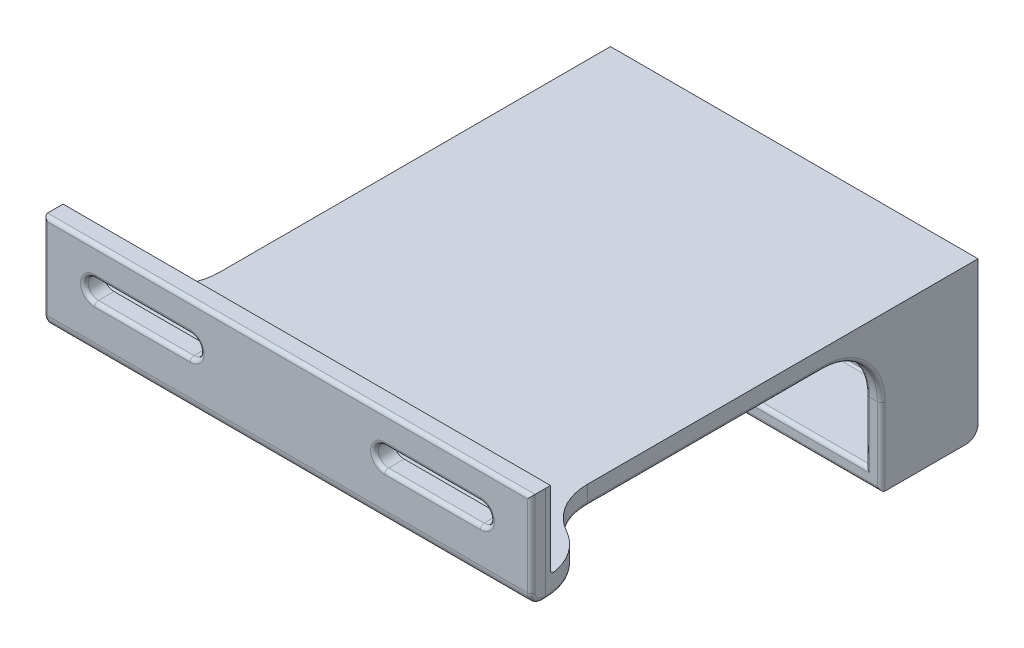
from build123d import *

# Parameters (mm, degrees)
SKETCH2_W           = 126
SKETCH2_H           = 20
SKETCH2_H_2         = 4.999999999999998
BOSS_EXTRUDE1_DEPTH = 5
CUT_EXTRUDE1_DEPTH  = 5
SKETCH4_W           = 126
SKETCH4_H           = 4.999999999999998
BOSS_EXTRUDE3_DEPTH = 10
SKETCH5_W           = 95
SKETCH5_H           = 4.999999999999998
BOSS_EXTRUDE4_DEPTH = 116
SKETCH6_W           = 95
SKETCH6_H           = 4
BOSS_EXTRUDE5_DEPTH = 35
BOSS_EXTRUDE6_DEPTH = 21
FILLET2_R           = 15
FILLET3_R           = 15
FILLET4_R           = 3
FILLET5_R           = 15
FILLET6_R           = 0.5
FILLET7_R           = 3
FILLET8_R           = 1
FILLET9_R           = 1


with BuildPart() as part:
    # Sketch2 → Boss-Extrude1 (new body)
    with BuildSketch(Plane.XY):
        with Locations((-1.976721396074229, 0.2999999999999954)):
            Rectangle(SKETCH2_W, SKETCH2_H)
        with Locations((-1.976721396074229, -12.200000000000003)):
            Rectangle(SKETCH2_W, SKETCH2_H_2)
    extrude(amount=BOSS_EXTRUDE1_DEPTH)

    # Sketch3 → Cut-Extrude1 (cut)
    with BuildSketch(Plane(origin=(0, 0, 0), x_dir=(-1, 0, 0), z_dir=(0, 0, -1))):
        with BuildLine():
            Line((27.126721396074235, 2.6), (51.82672139607423, 2.6))
            ThreePointArc((51.82672139607423, 2.6), (54.476721396074225, -0.04999999999999918), (51.82672139607423, -2.6999999999999984))
            Line((51.82672139607423, -2.6999999999999984), (27.126721396074235, -2.6999999999999984))
            ThreePointArc((27.126721396074235, -2.6999999999999984), (24.476721396074236, -0.04999999999999894), (27.126721396074235, 2.6))
        make_face()
        with BuildLine():
            Line((-23.173278603925766, -2.7000000000000055), (-47.87327860392578, -2.7000000000000055))
            ThreePointArc((-47.87327860392578, -2.7000000000000055), (-50.52327860392578, -0.05000000000000848), (-47.87327860392578, 2.5999999999999885))
            Line((-47.87327860392578, 2.5999999999999885), (-23.173278603925766, 2.5999999999999948))
            ThreePointArc((-23.173278603925766, 2.5999999999999948), (-20.523278603925768, -0.05000000000000534), (-23.173278603925766, -2.7000000000000055))
        make_face()
    extrude(amount=-CUT_EXTRUDE1_DEPTH, mode=Mode.SUBTRACT)

    # Sketch4 → Boss-Extrude3 (add)
    with BuildSketch(Plane(origin=(0, 0, 0), x_dir=(-1, 0, 0), z_dir=(0, 0, -1))):
        with Locations((1.976721396074229, -12.200000000000003)):
            Rectangle(SKETCH4_W, SKETCH4_H)
    extrude(amount=BOSS_EXTRUDE3_DEPTH)

    # Sketch5 → Boss-Extrude4 (add)
    with BuildSketch(Plane(origin=(0, 0, -10), x_dir=(-1, 0, 0), z_dir=(0, 0, -1))):
        with Locations((1.9767213960742254, -12.200000000000003)):
            Rectangle(SKETCH5_W, SKETCH5_H)
    extrude(amount=BOSS_EXTRUDE4_DEPTH)

    # Sketch6 → Boss-Extrude5 (add)
    with BuildSketch(Plane.XZ.offset(14.700000000000005)):
        with Locations((-1.9767213960742254, -124.00000000000001)):
            Rectangle(SKETCH6_W, SKETCH6_H)
    extrude(amount=BOSS_EXTRUDE5_DEPTH)

    # Sketch7 → Boss-Extrude6 (add)
    with BuildSketch(Plane.XY.offset(-122)):
        Polygon((-49.476721396074225, -30.70000000000001), (-49.476721396074225, -49.70000000000001), (45.523278603925775, -49.70000000000001), (45.523278603925775, -14.700000000000005), (41.52327860392578, -14.700000000000005), (41.52327860392579, -45.7), (-45.47672139607422, -45.70000000000002), (-45.476721396074225, -30.70000000000001), align=None)
    extrude(amount=BOSS_EXTRUDE6_DEPTH)

    # Fillet2
    fillet2_edges = [part.edges().sort_by_distance(p)[0] for p in [
        (45.523278603925775, -12.200000000000005, -10),
        (-49.476721396074225, -12.200000000000005, -10),
    ]]
    fillet(fillet2_edges, radius=FILLET2_R)

    # Fillet3
    # the kernel refuses this fillet: 15 mm, written as the material it takes off along each edge
    with BuildSketch(Plane(origin=(61.02327860392577, -42.857729933344494, -10), x_dir=(-0.9721461368215704, 0, -0.23437552914691517), z_dir=(0, 1, 0))) as fillet3_piece_1:
        with BuildLine():
            CenterArc((11.942398911242131, 14.4650042877501), FILLET3_R, 193.55481522372781, 61.096665460152735)
            Line((-2.6397931410814257, 10.949371350546373), (-4.098012346313782, 10.597808056826002))
            Line((-4.098012346313782, 10.597808056826002), (-1.4582192052323555, -0.35156329372037276))
            Line((-1.4582192052323555, -0.35156329372037276), (0.35156329372037276, -1.4582192052323555))
            ThreePointArc((0.35156329372037276, -1.4582192052323555), (0.8376363621311502, -1.3410314406588961), (7.575017813146935, -1.4465004287750098))
            Line((7.575017813146935, -1.4465004287750098), (7.972052458428318, 6e-17))
        make_face()
    extrude(amount=61.31545986668898, mode=Mode.SUBTRACT)
    with BuildSketch(Plane(origin=(-64.97672139607423, 18.45772993334451, -10), x_dir=(0.9721461368215705, 0, -0.23437552914691476), z_dir=(0, -1, 0))) as fillet3_piece_2:
        with BuildLine():
            CenterArc((11.942398911242128, 14.4650042877501), FILLET3_R, 193.55481522372781, 61.096665460152735)
            Line((-2.63979314108143, 10.949371350546382), (-4.098012346313785, 10.59780805682601))
            Line((-4.098012346313785, 10.59780805682601), (-1.4582192052323557, -0.35156329372037215))
            Line((-1.4582192052323557, -0.35156329372037215), (0.35156329372037215, -1.4582192052323557))
            ThreePointArc((0.35156329372037215, -1.4582192052323557), (0.8376363621311566, -1.3410314406588948), (7.575017813146934, -1.4465004287750098))
            Line((7.575017813146934, -1.4465004287750098), (7.972052458428317, -3e-17))
        make_face()
    extrude(amount=61.315459866689025, mode=Mode.SUBTRACT)

    # Fillet4
    fillet4_edges = [part.edges().sort_by_distance(p)[0] for p in [
        (-1.9767213960742254, -49.7, -126),
    ]]
    fillet(fillet4_edges, radius=FILLET4_R)

    # Fillet5
    fillet5_edges = [part.edges().sort_by_distance(p)[0] for p in [
        (43.523278603925775, -14.700000000000005, -101),
    ]]
    fillet(fillet5_edges, radius=FILLET5_R)

    # Fillet6
    fillet6_edges = [part.edges().sort_by_distance(p)[0] for p in [
        (-3.9767213960742183, -14.700000000000005, -122),
        (-47.476721396074225, -30.70000000000001, -122),
        (41.52327860392579, -30.200000000000003, -122),
        (-1.9767213960742112, -45.70000000000001, -122),
        (-45.476721396074225, -38.20000000000002, -122),
    ]]
    fillet(fillet6_edges, radius=FILLET6_R)

    # Fillet7
    fillet7_edges = [part.edges().sort_by_distance(p)[0] for p in [
        (-1.9767213960742325, -14.700000000000005, 5),
    ]]
    fillet(fillet7_edges, radius=FILLET7_R)

    # Fillet8
    fillet8_edges = [part.edges().sort_by_distance(p)[0] for p in [
        (-1.976721396074005, -9.700000000000005, 0),
    ]]
    fillet(fillet8_edges, radius=FILLET8_R)

    # Fillet9
    # the kernel refuses this fillet: 1 mm, written as the material it takes off along each edge
    with BuildSketch(Plane(origin=(-48.476721396074225, -31.70000000000001, -102), x_dir=(0, 0, 1), z_dir=(0, 1, 0))) as fillet9_piece_1_section:
        Polygon((0, 0), (FILLET9_R * 1.02, 0), (FILLET9_R * 1.02, -FILLET9_R * 1.02), (0, -FILLET9_R * 1.02), align=None)
    fillet9_piece_1 = extrude(amount=FILLET9_R * 1.02, mode=Mode.PRIVATE)
    fillet9_piece_1 = fillet9_piece_1 - Plane(origin=(-48.476721396074225, -31.70000000000001, -102), x_dir=(0.7071067811865475, 0, -0.7071067811865475), z_dir=(0, 1, 0)) * Sphere(FILLET9_R, mode=Mode.PRIVATE)
    add(fillet9_piece_1, mode=Mode.SUBTRACT)
    with BuildSketch(Plane(origin=(60.523278603925775, -14.700000000000005, -24.999999999999996), x_dir=(-1, 0, 0), z_dir=(0, 0, -1))) as fillet9_piece_2:
        with BuildLine():
            CenterArc((15 + FILLET9_R, FILLET9_R), FILLET9_R, 180, 90)
            Line((15, FILLET9_R), (15, 0))
            Line((15, 0), (15 + FILLET9_R, 0))
        make_face()
    revolve(axis=Axis((60.523278603925775, -14.700000000000005, -24.999999999999996), (0, 1, 0)), revolution_arc=61.09666546015381, mode=Mode.SUBTRACT)
    with BuildSketch(Plane(origin=(-64.47672139607423, -14.700000000000005, -24.999999999999996), x_dir=(0.483333333333338, 0, 0.8754363991112571), z_dir=(-0.8754363991112571, 0, 0.483333333333338))) as fillet9_piece_3:
        with BuildLine():
            CenterArc((15.000000000000005 + FILLET9_R, FILLET9_R), FILLET9_R, 180, 90.00000000000023)
            Line((15.000000000000005 + FILLET9_R, 0), (15.000000000000005, 0))
            Line((15.000000000000005, 0), (15.000000000000005, FILLET9_R))
        make_face()
    revolve(axis=Axis((-64.47672139607423, -14.700000000000005, -24.999999999999996), (0, 1, 0)), revolution_arc=61.09666546015241, mode=Mode.SUBTRACT)
    with BuildSketch(Plane(origin=(-49.97672139607436, -14.700000000000003, 1.2630919733380015), x_dir=(-0.48333333333331013, 0, -0.8754363991112726), z_dir=(0.8754363991112726, 0, -0.48333333333331013))) as fillet9_piece_4:
        with BuildLine():
            CenterArc((15 - FILLET9_R, FILLET9_R), FILLET9_R, 269.9999999999998, 90.00000000000023)
            Line((15 - FILLET9_R, 0), (15, 0))
            Line((15, 0), (15, FILLET9_R))
        make_face()
    revolve(axis=Axis((-49.97672139607436, -14.700000000000003, 1.2630919733380015), (0, 1, 0)), revolution_arc=61.096665460153005, mode=Mode.SUBTRACT)
    with BuildSketch(Plane(origin=(46.023278603926364, -14.700000000000003, 1.2630919733380015), x_dir=(0.48333333333331013, 0, -0.8754363991112726), z_dir=(-0.8754363991112726, 0, -0.48333333333331013))) as fillet9_piece_5:
        with BuildLine():
            CenterArc((15 - FILLET9_R, -FILLET9_R), FILLET9_R, 359.9999999999999, 90.00000000000011)
            Line((15, -FILLET9_R), (15, 0))
            Line((15, 0), (15 - FILLET9_R, 1.78e-15))
        make_face()
    revolve(axis=Axis((46.023278603926364, -14.700000000000003, 1.2630919733380015), (0, -1, 0)), revolution_arc=61.096665460153005, mode=Mode.SUBTRACT)
    with BuildSketch(Plane(origin=(41.52327860392578, -29.700000000000003, -101), x_dir=(0, 0, -1), z_dir=(2.3e-16, -1, 0))) as fillet9_piece_6:
        with BuildLine():
            CenterArc((FILLET9_R, FILLET9_R), FILLET9_R, 180, 90)
            Line((0, FILLET9_R), (0, 0))
            Line((0, 0), (FILLET9_R, 0))
        make_face()
    extrude(amount=16, mode=Mode.SUBTRACT)
    with BuildSketch(Plane(origin=(45.523278603925775, -14.700000000000005, -24.999999999999996), x_dir=(-1, 0, 0), z_dir=(0, 0, -1))) as fillet9_piece_7:
        with BuildLine():
            CenterArc((FILLET9_R, FILLET9_R), FILLET9_R, 180, 90)
            Line((0, FILLET9_R), (0, 0))
            Line((0, 0), (FILLET9_R, 0))
        make_face()
    extrude(amount=61, mode=Mode.SUBTRACT)
    with BuildSketch(Plane(origin=(41.52327860392579, -29.7, -86), x_dir=(0, 0, -1), z_dir=(0, -1, 0))) as fillet9_piece_8_section:
        with BuildLine():
            CenterArc((15 + FILLET9_R, FILLET9_R), FILLET9_R, 179.9999999999996, 90.0000000000004)
            Line((15, FILLET9_R), (15, 0))
            Line((15, 0), (15 + FILLET9_R, -7.11e-15))
        make_face()
    fillet9_piece_8 = revolve(axis=Axis((41.52327860392579, -29.7, -86), (1, 0, 0)), revolution_arc=118.65939784747897, mode=Mode.PRIVATE)
    fillet9_piece_8 = split(fillet9_piece_8, bisect_by=Plane(origin=(41.52327860392579, -14.700000000000005, -86), z_dir=(0, -1, 0)), keep=Keep.TOP, mode=Mode.PRIVATE)
    add(fillet9_piece_8, mode=Mode.SUBTRACT)
    with BuildSketch(Plane(origin=(45.523278603925775, -29.7, -86), x_dir=(0, 0, -1), z_dir=(0, -1, 0))) as fillet9_piece_9:
        with BuildLine():
            CenterArc((15 + FILLET9_R, -FILLET9_R), FILLET9_R, 90, 90)
            Line((15, -FILLET9_R), (15, 0))
            Line((15, 0), (15 + FILLET9_R, 0))
        make_face()
    revolve(axis=Axis((45.523278603925775, -29.7, -86), (1, 0, 0)), revolution_arc=90, mode=Mode.SUBTRACT)
    with BuildSketch(Plane(origin=(-49.476721396074225, -15.200000000000005, -122), x_dir=(0, 0, -1), z_dir=(0, -1, 0))) as fillet9_piece_10:
        with BuildLine():
            CenterArc((FILLET9_R, FILLET9_R), FILLET9_R, 180, 90)
            Line((0, FILLET9_R), (0, 0))
            Line((0, 0), (FILLET9_R, 0))
        make_face()
    extrude(amount=15.000000000000005, mode=Mode.SUBTRACT)
    with BuildSketch(Plane(origin=(-49.476721396074225, -14.700000000000005, -25), x_dir=(1, 0, 0), z_dir=(0, 0, -1))) as fillet9_piece_11:
        with BuildLine():
            CenterArc((FILLET9_R, -FILLET9_R), FILLET9_R, 90, 90)
            Line((-7.11e-15, -FILLET9_R), (0, 0))
            Line((0, 0), (FILLET9_R, 0))
        make_face()
    extrude(amount=96.5, mode=Mode.SUBTRACT)
    with BuildSketch(Plane(origin=(-49.476721396074225, -30.20000000000001, -121.5), x_dir=(0, 0, -1), z_dir=(0, 1, 0))) as fillet9_piece_12:
        with BuildLine():
            CenterArc((0.5 + FILLET9_R, -FILLET9_R), FILLET9_R, 90, 90)
            Line((0.5, -FILLET9_R), (0.5, 0))
            Line((0.5, 0), (0.5 + FILLET9_R, 0))
        make_face()
    revolve(axis=Axis((-49.476721396074225, -30.20000000000001, -121.5), (-1, 0, 0)), revolution_arc=90, mode=Mode.SUBTRACT)
    with BuildSketch(Plane(origin=(-49.47672139607422, -15.200000000000005, -121.5), x_dir=(0, 0, -1), z_dir=(0, -1, 0))) as fillet9_piece_13:
        with BuildLine():
            CenterArc((0.5 + FILLET9_R, FILLET9_R), FILLET9_R, 179.9999999999996, 90.0000000000004)
            Line((0.5, FILLET9_R), (0.5, 0))
            Line((0.5, 0), (0.5 + FILLET9_R, -7.11e-15))
        make_face()
    revolve(axis=Axis((-49.47672139607422, -15.200000000000005, -121.5), (1, 0, 0)), revolution_arc=90, mode=Mode.SUBTRACT)
    with BuildSketch(Plane(origin=(-64.97672139607423, 12.799999999999995, 5), x_dir=(0, 0, -1), z_dir=(0, -1, 0))) as fillet9_piece_14:
        with BuildLine():
            CenterArc((FILLET9_R, FILLET9_R), FILLET9_R, 180, 90)
            Line((0, FILLET9_R), (0, 0))
            Line((0, 0), (FILLET9_R, 0))
        make_face()
    extrude(amount=24.5, mode=Mode.SUBTRACT)
    with BuildSketch(Plane(origin=(61.02327860392577, 12.799999999999995, 5), x_dir=(-1, 0, 0), z_dir=(0, -1, 0))) as fillet9_piece_15:
        with BuildLine():
            CenterArc((FILLET9_R, FILLET9_R), FILLET9_R, 180, 90)
            Line((0, FILLET9_R), (0, 0))
            Line((0, 0), (FILLET9_R, 0))
        make_face()
    extrude(amount=24.5, mode=Mode.SUBTRACT)
    with BuildSketch(Plane(origin=(61.02327860392577, -14.700000000000005, 2.0000000000000004), x_dir=(-1, 0, 0), z_dir=(0, 0, -1))) as fillet9_piece_16:
        with BuildLine():
            CenterArc((FILLET9_R, FILLET9_R), FILLET9_R, 180, 90)
            Line((0, FILLET9_R), (0, 0))
            Line((0, 0), (FILLET9_R, 0))
        make_face()
    extrude(amount=0.7369080266624892, mode=Mode.SUBTRACT)
    with BuildSketch(Plane(origin=(61.02327860392577, -11.700000000000005, 2.0000000000000004), x_dir=(0, -1, 0), z_dir=(0, 0, -1))) as fillet9_piece_17:
        with BuildLine():
            CenterArc((3.0000000000000018 - FILLET9_R, FILLET9_R), FILLET9_R, 270, 90)
            Line((3.0000000000000018, FILLET9_R), (3.0000000000000018, 0))
            Line((3.0000000000000018, 0), (3.0000000000000018 - FILLET9_R, 0))
        make_face()
    revolve(axis=Axis((61.02327860392577, -11.700000000000005, 2.0000000000000004), (-1, 0, 0)), revolution_arc=90, mode=Mode.SUBTRACT)
    with BuildSketch(Plane(origin=(-64.97672139607423, -14.700000000000005, 2.0000000000000004), x_dir=(0, 1, 0), z_dir=(0, 0, -1))) as fillet9_piece_18:
        with BuildLine():
            CenterArc((FILLET9_R, FILLET9_R), FILLET9_R, 180.0000000000004, 89.9999999999996)
            Line((0, FILLET9_R), (0, 0))
            Line((0, 0), (FILLET9_R, 0))
        make_face()
    extrude(amount=0.7369080266624892, mode=Mode.SUBTRACT)
    with BuildSketch(Plane(origin=(-64.97672139607423, -11.700000000000005, 2.0000000000000004), x_dir=(0, -1, 0), z_dir=(0, 0, -1))) as fillet9_piece_19:
        with BuildLine():
            CenterArc((3.0000000000000018 - FILLET9_R, -FILLET9_R), FILLET9_R, 4.0711e-13, 89.9999999999996)
            Line((3.0000000000000018, -FILLET9_R), (3.0000000000000018, 0))
            Line((3.0000000000000018, 0), (3.0000000000000018 - FILLET9_R, 0))
        make_face()
    revolve(axis=Axis((-64.97672139607423, -11.700000000000005, 2.0000000000000004), (-1, 0, 0)), revolution_arc=90, mode=Mode.SUBTRACT)
    with BuildSketch(Plane(origin=(63.52327860392577, 10.299999999999995, 5), x_dir=(0, 0, -1), z_dir=(-1, 0, 0))) as fillet9_piece_20:
        with BuildLine():
            CenterArc((FILLET9_R, FILLET9_R), FILLET9_R, 180, 90)
            Line((0, FILLET9_R), (0, 0))
            Line((0, 0), (FILLET9_R, 0))
        make_face()
    extrude(amount=131, mode=Mode.SUBTRACT)
    with BuildSketch(Plane(origin=(-27.126721396074235, -0.04999999999999905, 5), x_dir=(0, -1, 0), z_dir=(-1, 0, 0))) as fillet9_piece_21:
        with BuildLine():
            CenterArc((2.6499999999999986 + FILLET9_R, -FILLET9_R), FILLET9_R, 90, 90)
            Line((2.6499999999999986 + FILLET9_R, 0), (2.6499999999999986, 0))
            Line((2.6499999999999986, 0), (2.6499999999999986, -FILLET9_R))
        make_face()
    revolve(axis=Axis((-27.126721396074235, -0.04999999999999905, 5), (0, 0, 1)), revolution_arc=180, mode=Mode.SUBTRACT)
    with BuildSketch(Plane(origin=(-27.126721396074235, 2.6, 5), x_dir=(0, 0, -1), z_dir=(-1, 0, 0)), Plane(origin=(-51.82672139607423, -2.6999999999999984, 5), x_dir=(0, 0, -1), z_dir=(1, 0, 0))) as fillet9_piece_22:
        with BuildLine():
            CenterArc((FILLET9_R, -FILLET9_R), FILLET9_R, 90, 90)
            Line((0, -FILLET9_R), (0, 0))
            Line((0, 0), (FILLET9_R, 0))
        make_face()
    extrude(amount=24.699999999999992, mode=Mode.SUBTRACT)
    with BuildSketch(Plane(origin=(-51.82672139607422, -0.04999999999999927, 5), x_dir=(-2.68e-15, 1, 0), z_dir=(1, 2.68e-15, 0))) as fillet9_piece_23:
        with BuildLine():
            CenterArc((2.6499999999999986 + FILLET9_R, -FILLET9_R), FILLET9_R, 90, 90)
            Line((2.6499999999999986 + FILLET9_R, 0), (2.6499999999999986, 0))
            Line((2.6499999999999986, 0), (2.6499999999999986, -FILLET9_R))
        make_face()
    revolve(axis=Axis((-51.82672139607422, -0.04999999999999927, 5), (0, 0, 1)), revolution_arc=179.9999999999997, mode=Mode.SUBTRACT)
    with BuildSketch(Plane(origin=(23.173278603925766, -0.0500000000000056, 5), x_dir=(0, 1, 0), z_dir=(1, 0, 0))) as fillet9_piece_24:
        with BuildLine():
            CenterArc((2.6499999999999986 + FILLET9_R, -FILLET9_R), FILLET9_R, 90, 90)
            Line((2.6499999999999986 + FILLET9_R, 0), (2.6499999999999986, 0))
            Line((2.6499999999999986, 0), (2.6499999999999986, -FILLET9_R))
        make_face()
    revolve(axis=Axis((23.173278603925766, -0.0500000000000056, 5), (0, 0, 1)), revolution_arc=180, mode=Mode.SUBTRACT)
    with BuildSketch(Plane(origin=(23.173278603925766, -2.7000000000000055, 5), x_dir=(0, 0, -1), z_dir=(1, 0, 0)), Plane(origin=(47.87327860392578, 2.5999999999999885, 5), x_dir=(0, 0, -1), z_dir=(-1, 2.5e-16, 0))) as fillet9_piece_25:
        with BuildLine():
            CenterArc((FILLET9_R, -FILLET9_R), FILLET9_R, 90, 90)
            Line((0, -FILLET9_R), (0, 0))
            Line((0, 0), (FILLET9_R, 0))
        make_face()
    extrude(amount=24.700000000000017, mode=Mode.SUBTRACT)
    with BuildSketch(Plane(origin=(47.87327860392579, -0.05000000000000837, 5), x_dir=(-2.68e-15, -1, 0), z_dir=(-1, 2.68e-15, 0))) as fillet9_piece_26:
        with BuildLine():
            CenterArc((2.6499999999999986 + FILLET9_R, -FILLET9_R), FILLET9_R, 90, 90)
            Line((2.6499999999999986 + FILLET9_R, 0), (2.6499999999999986, 0))
            Line((2.6499999999999986, 0), (2.6499999999999986, -FILLET9_R))
        make_face()
    revolve(axis=Axis((47.87327860392579, -0.05000000000000837, 5), (0, 0, 1)), revolution_arc=180.0000000000003, mode=Mode.SUBTRACT)
    with BuildSketch(Plane(origin=(-49.476721396074225, -30.70000000000001, -121.5), x_dir=(0, -1, 0), z_dir=(0, 0, 1))) as fillet9_piece_27:
        with BuildLine():
            CenterArc((FILLET9_R, FILLET9_R), FILLET9_R, 180, 90)
            Line((0, FILLET9_R), (0, 0))
            Line((0, 0), (FILLET9_R, 0))
        make_face()
    extrude(amount=19.5, mode=Mode.SUBTRACT)
    with BuildSketch(Plane(origin=(-42.976721396074225, -30.70000000000001, -101), x_dir=(0, -1, 0), z_dir=(-1, 0, 0))) as fillet9_piece_28:
        with BuildLine():
            CenterArc((FILLET9_R, -FILLET9_R), FILLET9_R, 90, 90)
            Line((0, -FILLET9_R), (0, 0))
            Line((0, 0), (FILLET9_R, 0))
        make_face()
    extrude(amount=5.5, mode=Mode.SUBTRACT)
    with BuildSketch(Plane(origin=(-49.476721396074225, -31.70000000000001, -101), x_dir=(0, 0, -1), z_dir=(0, -1, 0))) as fillet9_piece_29:
        with BuildLine():
            CenterArc((FILLET9_R, FILLET9_R), FILLET9_R, 180, 90)
            Line((0, FILLET9_R), (0, 0))
            Line((0, 0), (FILLET9_R, 0))
        make_face()
    extrude(amount=20.5, mode=Mode.SUBTRACT)
    with BuildSketch(Plane(origin=(-51.976721396074225, -49.70000000000001, -101), x_dir=(0, 1, 0), z_dir=(1, 0, 0))) as fillet9_piece_30:
        with BuildLine():
            CenterArc((FILLET9_R, -FILLET9_R), FILLET9_R, 90, 90)
            Line((0, -FILLET9_R), (0, 0))
            Line((0, 0), (FILLET9_R, 0))
        make_face()
    extrude(amount=100.00000000000001, mode=Mode.SUBTRACT)
    with BuildSketch(Plane(origin=(45.523278603925775, -52.20000000000001, -101), x_dir=(0, 0, -1), z_dir=(0, 1, 0))) as fillet9_piece_31:
        with BuildLine():
            CenterArc((FILLET9_R, FILLET9_R), FILLET9_R, 180, 90)
            Line((0, FILLET9_R), (0, 0))
            Line((0, 0), (FILLET9_R, 0))
        make_face()
    extrude(amount=22.50000000000001, mode=Mode.SUBTRACT)
    with BuildSketch(Plane(origin=(41.52327860392579, -45.7, -101), x_dir=(1.6e-16, -1, 0), z_dir=(-1, -1.6e-16, 0))) as fillet9_piece_32:
        with BuildLine():
            CenterArc((FILLET9_R, -FILLET9_R), FILLET9_R, 90, 90)
            Line((0, -FILLET9_R), (0, 0))
            Line((0, 0), (FILLET9_R, 0))
        make_face()
    extrude(amount=87, mode=Mode.SUBTRACT)
    with BuildSketch(Plane(origin=(-45.47672139607422, -45.70000000000002, -101), x_dir=(-1, -4.7e-16, 0), z_dir=(-4.7e-16, 1, 0))) as fillet9_piece_33:
        with BuildLine():
            CenterArc((FILLET9_R, -FILLET9_R), FILLET9_R, 90, 90)
            Line((0, -FILLET9_R), (0, 0))
            Line((0, 0), (FILLET9_R, 0))
        make_face()
    extrude(amount=17.500000000000007, mode=Mode.SUBTRACT)
    with BuildSketch(Plane(origin=(41.52327860392578, -29.700000000000003, -101), x_dir=(0, 0, -1), z_dir=(2.3e-16, -1, 0))) as fillet9_piece_34a_section:
        with BuildLine():
            CenterArc((FILLET9_R, FILLET9_R), FILLET9_R, 180, 90)
            Line((0, FILLET9_R), (0, 0))
            Line((0, 0), (FILLET9_R, 0))
        make_face()
    fillet9_piece_34a = extrude(amount=18.5, mode=Mode.PRIVATE)
    fillet9_piece_34a = split(fillet9_piece_34a, bisect_by=Plane(origin=(41.52327860392578, -45.7, -101), z_dir=(1.6e-16, -1, 0)), keep=Keep.TOP, mode=Mode.PRIVATE)
    with BuildSketch(Plane(origin=(44.02327860392579, -45.7, -101), x_dir=(1.6e-16, -1, 0), z_dir=(-1, -1.6e-16, 0))) as fillet9_piece_34b_section:
        with BuildLine():
            CenterArc((FILLET9_R, -FILLET9_R), FILLET9_R, 90, 90)
            Line((0, -FILLET9_R), (0, 0))
            Line((0, 0), (FILLET9_R, 0))
        make_face()
    fillet9_piece_34b = extrude(amount=89.5, mode=Mode.PRIVATE)
    fillet9_piece_34b = split(fillet9_piece_34b, bisect_by=Plane(origin=(41.52327860392579, -45.7, -101), z_dir=(1, 2.3e-16, 0)), keep=Keep.TOP, mode=Mode.PRIVATE)
    fillet9_piece_34 = fillet9_piece_34a & fillet9_piece_34b
    add(fillet9_piece_34, mode=Mode.SUBTRACT)
    with BuildSketch(Plane(origin=(41.52327860392579, -45.7, -101), x_dir=(1.6e-16, -1, 0), z_dir=(-1, -1.6e-16, 0))) as fillet9_piece_35a_section:
        with BuildLine():
            CenterArc((FILLET9_R, -FILLET9_R), FILLET9_R, 90, 90)
            Line((0, -FILLET9_R), (0, 0))
            Line((0, 0), (FILLET9_R, 0))
        make_face()
    fillet9_piece_35a = extrude(amount=89.5, mode=Mode.PRIVATE)
    fillet9_piece_35a = split(fillet9_piece_35a, bisect_by=Plane(origin=(-45.47672139607421, -45.700000000000045, -101), z_dir=(-1, -4.7e-16, 0)), keep=Keep.TOP, mode=Mode.PRIVATE)
    with BuildSketch(Plane(origin=(-45.47672139607422, -48.20000000000002, -101), x_dir=(-1, -4.7e-16, 0), z_dir=(-4.7e-16, 1, 0))) as fillet9_piece_35b_section:
        with BuildLine():
            CenterArc((FILLET9_R, -FILLET9_R), FILLET9_R, 90, 90)
            Line((0, -FILLET9_R), (0, 0))
            Line((0, 0), (FILLET9_R, 0))
        make_face()
    fillet9_piece_35b = extrude(amount=17.500000000000007, mode=Mode.PRIVATE)
    fillet9_piece_35b = split(fillet9_piece_35b, bisect_by=Plane(origin=(-45.47672139607422, -45.70000000000002, -101), z_dir=(1.6e-16, -1, 0)), keep=Keep.TOP, mode=Mode.PRIVATE)
    fillet9_piece_35 = fillet9_piece_35a & fillet9_piece_35b
    add(fillet9_piece_35, mode=Mode.SUBTRACT)


solid = part.part
